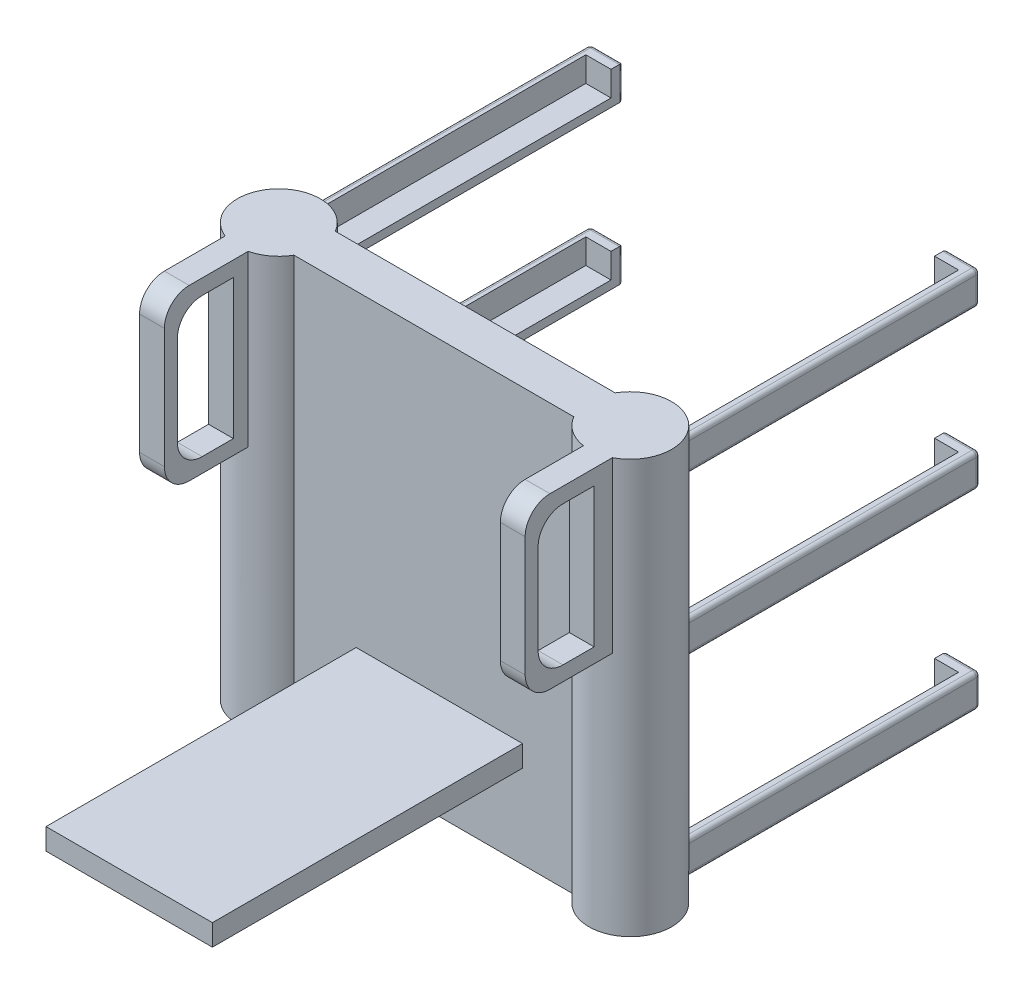
from build123d import *

# Parameters (mm, degrees)
EXTRUDE_2_DEPTH     = 100
EXTRUDE_3_REACH     = 145.614
SKETCH_5_W          = 13.54833094
SKETCH_5_H          = 33.732579075
CUT_EXTRUDE_1_DEPTH = 163.864974749
FILLET_1_R          = 6
SKETCH_6_W          = 8
SKETCH_6_H          = 92.249217012
CUT_EXTRUDE_2_DEPTH = 10
SKETCH_7_W          = 8
SKETCH_7_H          = 8
SKETCH_7_H_2        = 7.999996174
EXTRUDE_4_DEPTH     = 80
SKETCH_8_W          = 5.81077623
SKETCH_8_H          = 6
SKETCH_8_W_2        = 6.08515434
CUT_EXTRUDE_3_DEPTH = 70
FILLET_2_R          = 1
FILLET_3_R          = 1
SCALE_1_SCALE       = 0.4
SKETCH_10_W         = 16.095665038
SKETCH_10_H         = 2.058747854
EXTRUDE_5_DEPTH     = 30


with BuildPart() as part:
    # 草图1 → 凸台-拉伸2 (new body)
    with BuildSketch(Plane(origin=(0, 0, 0), x_dir=(1, 0, 0), z_dir=(0, 1, 0))):
        with BuildLine():
            Line((8.660254038, -5), (76.339745962, -5))
            ThreePointArc((76.339745962, -5), (95, 0), (76.339745962, 5))
            Line((76.339745962, 5), (8.660254038, 5))
            ThreePointArc((8.660254038, 5), (-10, 0), (8.660254038, -5))
        make_face()
    extrude(amount=EXTRUDE_2_DEPTH)

    # 草图4 → 凸台-拉伸3 (add, up to next)
    with BuildSketch(Plane.XY.offset(30), mode=Mode.PRIVATE) as extrude_3_sk1:
        Polygon((2.330127019, 100), (-0.669872981, 100), (-3.669872981, 100), (-3.669872981, 70), (-3.669872981, 59.040164867), (2.330127019, 59.040164867), (2.330127019, 70), align=None)
    extrude_3_tool1 = extrude(extrude_3_sk1.sketch, amount=-EXTRUDE_3_REACH, mode=Mode.PRIVATE) - part.part
    # 草图4 → 凸台-拉伸3 (add, up to next)
    with BuildSketch(Plane.XY.offset(30), mode=Mode.PRIVATE) as extrude_3_sk2:
        Polygon((89.57207168, 100), (85.669872981, 100), (83.57207168, 100), (83.57207168, 70), (83.57207168, 59.040164867), (89.57207168, 59.040164867), (89.57207168, 70), align=None)
    extrude_3_tool2 = extrude(extrude_3_sk2.sketch, amount=-EXTRUDE_3_REACH, mode=Mode.PRIVATE) - part.part
    add(extrude_3_tool1.solids().sort_by_distance((-0.669873, 79.520082, 30))[0])
    add(extrude_3_tool2.solids().sort_by_distance((86.572072, 79.520082, 30))[0])

    # 草图5 → 切除-拉伸1 (cut, through all)
    with BuildSketch(Plane(origin=(-30, 0, 0), x_dir=(0, 0, -1), z_dir=(1, 0, 0))):
        with Locations((-20.092124067, 79.446882552)):
            Rectangle(SKETCH_5_W, SKETCH_5_H)
    extrude(amount=CUT_EXTRUDE_1_DEPTH, mode=Mode.SUBTRACT)

    # 圆角1
    fillet_1_edges = [part.edges().sort_by_distance(p)[0] for p in [
        (-0.669872981, 59.040164867, 30),
        (-0.669872981, 100, 30),
        (86.57207168, 59.040164867, 30),
        (86.57207168, 100, 30),
        (-0.669872981, 96.31317209, 26.866289537),
        (86.57207168, 96.31317209, 26.866289537),
        (-0.669872981, 62.580593015, 26.866289537),
        (86.57207168, 62.580593015, 26.866289537),
    ]]
    fillet(fillet_1_edges, radius=FILLET_1_R)

    # 草图6 → 切除-拉伸2 (cut)
    with BuildSketch(Plane.XY.offset(-10)):
        with Locations((-0.669872981, 49.12740992)):
            Rectangle(SKETCH_6_W, SKETCH_6_H)
        Polygon((89.666936202, 3.002801414), (89.576715268, 95.252018426), (81.57207168, 95.252018426), (81.57207168, 3.002801414), align=None)
    extrude(amount=CUT_EXTRUDE_2_DEPTH, mode=Mode.SUBTRACT)

    # 草图7 → 凸台-拉伸4 (add)
    with BuildSketch(Plane.XY.offset(-80)):
        Polygon((89.666936202, 3.002801414), (81.57207168, 3.002801414), (81.57207168, 11.002801414), (89.659112098, 11.002801414), align=None)
        with Locations((-0.669872981, 7.002801414)):
            Rectangle(SKETCH_7_W, SKETCH_7_H)
        Polygon((89.621825735, 49.12740992), (81.57207168, 49.12740992), (81.57207168, 57.127406094), (89.614001635, 57.127406094), align=None)
        with Locations((-0.669872981, 53.127408007)):
            Rectangle(SKETCH_7_W, SKETCH_7_H_2)
        with Locations((-0.669872981, 91.252018426)):
            Rectangle(SKETCH_7_W, SKETCH_7_H)
        Polygon((81.57207168, 95.252018426), (89.576715268, 95.252018426), (89.584539372, 87.252018426), (81.57207168, 87.252018426), align=None)
    extrude(amount=EXTRUDE_4_DEPTH)

    # 草图8 → 切除-拉伸3 (cut)
    with BuildSketch(Plane.XY.offset(-77)):
        with Locations((84.477459795, 92.252018426)):
            Rectangle(SKETCH_8_W, SKETCH_8_H)
        with Locations((84.477459795, 54.127406094)):
            Rectangle(SKETCH_8_W, SKETCH_8_H)
        with Locations((84.477459795, 8.002801414)):
            Rectangle(SKETCH_8_W, SKETCH_8_H)
        with Locations((0.287549849, 8.002801414)):
            Rectangle(SKETCH_8_W_2, SKETCH_8_H)
        with Locations((0.287549849, 54.127406094)):
            Rectangle(SKETCH_8_W_2, SKETCH_8_H)
        with Locations((0.287549849, 92.252018426)):
            Rectangle(SKETCH_8_W_2, SKETCH_8_H)
    extrude(amount=CUT_EXTRUDE_3_DEPTH, mode=Mode.SUBTRACT)

    # 圆角2
    fillet_2_edges = [part.edges().sort_by_distance(p)[0] for p in [
        (89.58062732, 91.252018426, -80),
        (89.617913685, 53.127408007, -80),
        (89.66302415, 7.002801414, -80),
        (-4.669872981, 7.002801414, -80),
        (-4.669872981, 91.252018426, -80),
        (-4.669872981, 53.127408007, -80),
        (-4.669872981, 87.252018426, -44.421320118),
        (-4.669872981, 49.12740992, -44.421320118),
        (-4.669872981, 3.002801414, -44.421320118),
        (-4.669872981, 11.002801414, -44.421320118),
        (-4.669872981, 57.127406094, -44.421320118),
        (-4.669872981, 95.252018426, -44.421320118),
        (89.584539372, 87.252018426, -44.443590855),
        (89.621825735, 49.12740992, -44.433923964),
        (89.666936202, 3.002801414, -44.422095275),
        (89.659112098, 11.002801414, -44.42415739),
        (89.614001635, 57.127406094, -44.435960688),
        (89.576715268, 95.252018426, -44.445606746),
    ]]
    fillet(fillet_2_edges, radius=FILLET_2_R)

    # 圆角3
    # the kernel refuses this fillet: 1 mm, written as the material it takes off along each edge
    with BuildSketch(Plane(origin=(88.665957711, 4.002801414, -79), x_dir=(0.9999995217456177, 0.0009780125439468655, 0), z_dir=(0, 0, -1))) as fillet_3_piece_1_section:
        Polygon((0, 0), (FILLET_3_R, 0), (FILLET_3_R, FILLET_3_R * 1.00097849127), (-FILLET_3_R * 0.000978012543947, FILLET_3_R * 0.999999521746), align=None)
    fillet_3_piece_1 = extrude(amount=FILLET_3_R, mode=Mode.PRIVATE)
    fillet_3_piece_1 = fillet_3_piece_1 - Plane(origin=(88.665957711, 4.002801414, -79), x_dir=(-0.707452476334611, 0.7067609169500155, 0), z_dir=(0, 0, -1)) * Sphere(FILLET_3_R, mode=Mode.PRIVATE)
    add(fillet_3_piece_1, mode=Mode.SUBTRACT)
    with BuildSketch(Plane(origin=(88.660089633, 10.002801414, -79), x_dir=(0.9999995217456177, 0.0009780125439468655, 0), z_dir=(0, 0, -1))) as fillet_3_piece_2_section:
        Polygon((0, 0), (FILLET_3_R, 0), (FILLET_3_R, -FILLET_3_R * 0.999022465243), (FILLET_3_R * 0.000978012543947, -FILLET_3_R * 0.999999521746), align=None)
    fillet_3_piece_2 = extrude(amount=FILLET_3_R, mode=Mode.PRIVATE)
    fillet_3_piece_2 = fillet_3_piece_2 - Plane(origin=(88.660089633, 10.002801414, -79), x_dir=(-0.7067609169500155, -0.7074524763346108, 0), z_dir=(0, 0, -1)) * Sphere(FILLET_3_R, mode=Mode.PRIVATE)
    add(fillet_3_piece_2, mode=Mode.SUBTRACT)
    with BuildSketch(Plane(origin=(88.620847244, 50.12740992, -79), x_dir=(0.9999995217456177, 0.0009780125439480245, 0), z_dir=(0, 0, -1))) as fillet_3_piece_3_section:
        Polygon((0, 0), (FILLET_3_R, 0), (FILLET_3_R, FILLET_3_R * 1.00097849127), (-FILLET_3_R * 0.000978012543949, FILLET_3_R * 0.999999521746), align=None)
    fillet_3_piece_3 = extrude(amount=FILLET_3_R, mode=Mode.PRIVATE)
    fillet_3_piece_3 = fillet_3_piece_3 - Plane(origin=(88.620847244, 50.12740992, -79), x_dir=(-0.7074524763346112, 0.7067609169500152, 0), z_dir=(0, 0, -1)) * Sphere(FILLET_3_R, mode=Mode.PRIVATE)
    add(fillet_3_piece_3, mode=Mode.SUBTRACT)
    with BuildSketch(Plane(origin=(88.614979169, 56.127406094, -79), x_dir=(0.9999995217456177, 0.0009780125439480245, 0), z_dir=(0, 0, -1))) as fillet_3_piece_4_section:
        Polygon((0, 0), (FILLET_3_R, 0), (FILLET_3_R, -FILLET_3_R * 0.999022465243), (FILLET_3_R * 0.000978012543948, -FILLET_3_R * 0.999999521746), align=None)
    fillet_3_piece_4 = extrude(amount=FILLET_3_R, mode=Mode.PRIVATE)
    fillet_3_piece_4 = fillet_3_piece_4 - Plane(origin=(88.614979169, 56.127406094, -79), x_dir=(-0.7067609169500151, -0.7074524763346115, 0), z_dir=(0, 0, -1)) * Sphere(FILLET_3_R, mode=Mode.PRIVATE)
    add(fillet_3_piece_4, mode=Mode.SUBTRACT)
    with BuildSketch(Plane(origin=(-3.669872981, 94.252018426, -79), x_dir=(0, 0, -1), z_dir=(0, 1, 0))) as fillet_3_piece_5_section:
        Polygon((0, 0), (FILLET_3_R, 0), (FILLET_3_R, FILLET_3_R), (0, FILLET_3_R), align=None)
    fillet_3_piece_5 = extrude(amount=FILLET_3_R, mode=Mode.PRIVATE)
    fillet_3_piece_5 = fillet_3_piece_5 - Plane(origin=(-3.669872981, 94.252018426, -79), x_dir=(0.7071067811865475, 0, 0.7071067811865475), z_dir=(0, 1, 0)) * Sphere(FILLET_3_R, mode=Mode.PRIVATE)
    add(fillet_3_piece_5, mode=Mode.SUBTRACT)
    with BuildSketch(Plane(origin=(-3.669872981, 88.252018426, -79), x_dir=(0, 0, -1), z_dir=(0, -1, 0))) as fillet_3_piece_6_section:
        Polygon((0, 0), (FILLET_3_R, 0), (FILLET_3_R, -FILLET_3_R), (0, -FILLET_3_R), align=None)
    fillet_3_piece_6 = extrude(amount=FILLET_3_R, mode=Mode.PRIVATE)
    fillet_3_piece_6 = fillet_3_piece_6 - Plane(origin=(-3.669872981, 88.252018426, -79), x_dir=(0.7071067811865475, 0, 0.7071067811865475), z_dir=(0, -1, 0)) * Sphere(FILLET_3_R, mode=Mode.PRIVATE)
    add(fillet_3_piece_6, mode=Mode.SUBTRACT)
    with BuildSketch(Plane(origin=(-3.669872981, 10.002801414, -79), x_dir=(0, 0, -1), z_dir=(0, 1, 0))) as fillet_3_piece_7_section:
        Polygon((0, 0), (FILLET_3_R, 0), (FILLET_3_R, FILLET_3_R), (0, FILLET_3_R), align=None)
    fillet_3_piece_7 = extrude(amount=FILLET_3_R, mode=Mode.PRIVATE)
    fillet_3_piece_7 = fillet_3_piece_7 - Plane(origin=(-3.669872981, 10.002801414, -79), x_dir=(0.7071067811865475, 0, 0.7071067811865475), z_dir=(0, 1, 0)) * Sphere(FILLET_3_R, mode=Mode.PRIVATE)
    add(fillet_3_piece_7, mode=Mode.SUBTRACT)
    with BuildSketch(Plane(origin=(-3.669872981, 4.002801414, -79), x_dir=(0, 0, -1), z_dir=(0, -1, 0))) as fillet_3_piece_8_section:
        Polygon((0, 0), (FILLET_3_R, 0), (FILLET_3_R, -FILLET_3_R), (0, -FILLET_3_R), align=None)
    fillet_3_piece_8 = extrude(amount=FILLET_3_R, mode=Mode.PRIVATE)
    fillet_3_piece_8 = fillet_3_piece_8 - Plane(origin=(-3.669872981, 4.002801414, -79), x_dir=(0.7071067811865475, 0, 0.7071067811865475), z_dir=(0, -1, 0)) * Sphere(FILLET_3_R, mode=Mode.PRIVATE)
    add(fillet_3_piece_8, mode=Mode.SUBTRACT)
    with BuildSketch(Plane(origin=(-3.669872981, 56.127406094, -79), x_dir=(0, 0, -1), z_dir=(0, 1, 0))) as fillet_3_piece_9_section:
        Polygon((0, 0), (FILLET_3_R, 0), (FILLET_3_R, FILLET_3_R), (0, FILLET_3_R), align=None)
    fillet_3_piece_9 = extrude(amount=FILLET_3_R, mode=Mode.PRIVATE)
    fillet_3_piece_9 = fillet_3_piece_9 - Plane(origin=(-3.669872981, 56.127406094, -79), x_dir=(0.7071067811865475, 0, 0.7071067811865475), z_dir=(0, 1, 0)) * Sphere(FILLET_3_R, mode=Mode.PRIVATE)
    add(fillet_3_piece_9, mode=Mode.SUBTRACT)
    with BuildSketch(Plane(origin=(-3.669872981, 50.12740992, -79), x_dir=(0, 0, -1), z_dir=(0, -1, 0))) as fillet_3_piece_10_section:
        Polygon((0, 0), (FILLET_3_R, 0), (FILLET_3_R, -FILLET_3_R), (0, -FILLET_3_R), align=None)
    fillet_3_piece_10 = extrude(amount=FILLET_3_R, mode=Mode.PRIVATE)
    fillet_3_piece_10 = fillet_3_piece_10 - Plane(origin=(-3.669872981, 50.12740992, -79), x_dir=(0.7071067811865475, 0, 0.7071067811865475), z_dir=(0, -1, 0)) * Sphere(FILLET_3_R, mode=Mode.PRIVATE)
    add(fillet_3_piece_10, mode=Mode.SUBTRACT)
    with BuildSketch(Plane(origin=(88.58356088, 88.252018426, -79), x_dir=(0.9999995217456177, 0.0009780125439468638, 0), z_dir=(0, 0, -1))) as fillet_3_piece_11_section:
        Polygon((0, 0), (FILLET_3_R, 0), (FILLET_3_R, FILLET_3_R * 1.00097849127), (-FILLET_3_R * 0.000978012543947, FILLET_3_R * 0.999999521746), align=None)
    fillet_3_piece_11 = extrude(amount=FILLET_3_R, mode=Mode.PRIVATE)
    fillet_3_piece_11 = fillet_3_piece_11 - Plane(origin=(88.58356088, 88.252018426, -79), x_dir=(-0.7074524763346112, 0.7067609169500153, 0), z_dir=(0, 0, -1)) * Sphere(FILLET_3_R, mode=Mode.PRIVATE)
    add(fillet_3_piece_11, mode=Mode.SUBTRACT)
    with BuildSketch(Plane(origin=(88.577692802, 94.252018426, -79), x_dir=(0.9999995217456177, 0.0009780125439468638, 0), z_dir=(0, 0, -1))) as fillet_3_piece_12_section:
        Polygon((0, 0), (FILLET_3_R, 0), (FILLET_3_R, -FILLET_3_R * 0.999022465243), (FILLET_3_R * 0.000978012543947, -FILLET_3_R * 0.999999521746), align=None)
    fillet_3_piece_12 = extrude(amount=FILLET_3_R, mode=Mode.PRIVATE)
    fillet_3_piece_12 = fillet_3_piece_12 - Plane(origin=(88.577692802, 94.252018426, -79), x_dir=(-0.7067609169500155, -0.7074524763346111, 0), z_dir=(0, 0, -1)) * Sphere(FILLET_3_R, mode=Mode.PRIVATE)
    add(fillet_3_piece_12, mode=Mode.SUBTRACT)
    with BuildSketch(Plane(origin=(81.57207168, 0.502801414, -80), x_dir=(0, 0, 1), z_dir=(0, 1, 0)), Plane(origin=(3.330127019, 97.752018426, -80), x_dir=(0, 0, 1), z_dir=(0, -1, 0)), Plane(origin=(3.330127019, 13.502801414, -80), x_dir=(0, 0, 1), z_dir=(0, -1, 0)), Plane(origin=(81.57207168, 84.752018426, -80), x_dir=(0, 0, 1), z_dir=(0, 1, 0))) as fillet_3_piece_13:
        with BuildLine():
            CenterArc((FILLET_3_R, FILLET_3_R), FILLET_3_R, 180, 90)
            Line((0, FILLET_3_R), (0, 0))
            Line((0, 0), (FILLET_3_R, 0))
        make_face()
    extrude(amount=13, mode=Mode.SUBTRACT)
    with BuildSketch(Plane(origin=(88.665957711, 3.002801414, -80), x_dir=(0, 0, 1), z_dir=(-1, 0, 0))) as fillet_3_piece_14:
        with BuildLine():
            CenterArc((FILLET_3_R, FILLET_3_R), FILLET_3_R, 180, 90)
            Line((0, FILLET_3_R), (0, 0))
            Line((0, 0), (FILLET_3_R, 0))
        make_face()
    extrude(amount=9.593886031, mode=Mode.SUBTRACT)
    with BuildSketch(Plane(origin=(79.07207168, 11.002801414, -80), x_dir=(0, 0, 1), z_dir=(1, 0, 0))) as fillet_3_piece_15:
        with BuildLine():
            CenterArc((FILLET_3_R, FILLET_3_R), FILLET_3_R, 180, 90)
            Line((0, FILLET_3_R), (0, 0))
            Line((0, 0), (FILLET_3_R, 0))
        make_face()
    extrude(amount=9.588017953, mode=Mode.SUBTRACT)
    with BuildSketch(Plane(origin=(81.57207168, 46.62740992, -80), x_dir=(0, 0, 1), z_dir=(0, 1, 0))) as fillet_3_piece_16:
        with BuildLine():
            CenterArc((FILLET_3_R, FILLET_3_R), FILLET_3_R, 180, 90)
            Line((0, FILLET_3_R), (0, 0))
            Line((0, 0), (FILLET_3_R, 0))
        make_face()
    extrude(amount=12.999996174, mode=Mode.SUBTRACT)
    with BuildSketch(Plane(origin=(88.620847244, 49.12740992, -80), x_dir=(0, 0, 1), z_dir=(-1, 0, 0))) as fillet_3_piece_17:
        with BuildLine():
            CenterArc((FILLET_3_R, FILLET_3_R), FILLET_3_R, 180, 90)
            Line((0, FILLET_3_R), (0, 0))
            Line((0, 0), (FILLET_3_R, 0))
        make_face()
    extrude(amount=9.548775564, mode=Mode.SUBTRACT)
    with BuildSketch(Plane(origin=(79.07207168, 57.127406094, -80), x_dir=(0, 0, 1), z_dir=(1, 0, 0))) as fillet_3_piece_18:
        with BuildLine():
            CenterArc((FILLET_3_R, FILLET_3_R), FILLET_3_R, 180, 90)
            Line((0, FILLET_3_R), (0, 0))
            Line((0, 0), (FILLET_3_R, 0))
        make_face()
    extrude(amount=9.542907489, mode=Mode.SUBTRACT)
    with BuildSketch(Plane(origin=(-3.669872981, 95.252018426, -80), x_dir=(0, 0, 1), z_dir=(1, 0, 0)), Plane(origin=(5.830127019, 87.252018426, -80), x_dir=(0, 0, 1), z_dir=(-1, 0, 0)), Plane(origin=(-3.669872981, 11.002801414, -80), x_dir=(0, 0, 1), z_dir=(1, 0, 0)), Plane(origin=(5.830127019, 3.002801414, -80), x_dir=(0, 0, 1), z_dir=(-1, 0, 0))) as fillet_3_piece_19:
        with BuildLine():
            CenterArc((FILLET_3_R, FILLET_3_R), FILLET_3_R, 180, 90)
            Line((0, FILLET_3_R), (0, 0))
            Line((0, 0), (FILLET_3_R, 0))
        make_face()
    extrude(amount=9.5, mode=Mode.SUBTRACT)
    with BuildSketch(Plane(origin=(3.330127019, 46.62740992, -80), x_dir=(0, 0, 1), z_dir=(0, 1, 0))) as fillet_3_piece_20:
        with BuildLine():
            CenterArc((FILLET_3_R, -FILLET_3_R), FILLET_3_R, 90, 90)
            Line((0, -FILLET_3_R), (0, 0))
            Line((0, 0), (FILLET_3_R, 0))
        make_face()
    extrude(amount=12.999996174, mode=Mode.SUBTRACT)
    with BuildSketch(Plane(origin=(5.830127019, 57.127406094, -80), x_dir=(0, 0, 1), z_dir=(-1, 0, 0)), Plane(origin=(-3.669872981, 49.12740992, -80), x_dir=(0, 0, 1), z_dir=(1, 0, 0))) as fillet_3_piece_21:
        with BuildLine():
            CenterArc((FILLET_3_R, -FILLET_3_R), FILLET_3_R, 90, 90)
            Line((0, -FILLET_3_R), (0, 0))
            Line((0, 0), (FILLET_3_R, 0))
        make_face()
    extrude(amount=9.5, mode=Mode.SUBTRACT)
    with BuildSketch(Plane(origin=(88.58356088, 87.252018426, -80), x_dir=(0, 0, 1), z_dir=(-1, 0, 0))) as fillet_3_piece_22:
        with BuildLine():
            CenterArc((FILLET_3_R, FILLET_3_R), FILLET_3_R, 180, 90)
            Line((0, FILLET_3_R), (0, 0))
            Line((0, 0), (FILLET_3_R, 0))
        make_face()
    extrude(amount=9.511489201, mode=Mode.SUBTRACT)
    with BuildSketch(Plane(origin=(79.07207168, 95.252018426, -80), x_dir=(0, 0, 1), z_dir=(1, 0, 0))) as fillet_3_piece_23:
        with BuildLine():
            CenterArc((FILLET_3_R, FILLET_3_R), FILLET_3_R, 180, 90)
            Line((0, FILLET_3_R), (0, 0))
            Line((0, 0), (FILLET_3_R, 0))
        make_face()
    extrude(amount=9.505621123, mode=Mode.SUBTRACT)


with BuildPart() as part_1:
    # 缩放比例1: scaled about (42.655927146, 51.005075462, -3.237606987)
    add(part.part.scale(SCALE_1_SCALE).moved(Location((25.593556288, 30.603045277, -1.942564192))))


with BuildPart() as extrude_5_tool:
    # 草图10 → 凸台-拉伸5 (new body)
    with BuildSketch(Plane.XY.offset(0.057440609)):
        with Locations((43.123839108, 39.716636815)):
            Rectangle(SKETCH_10_W, SKETCH_10_H)
    extrude(amount=EXTRUDE_5_DEPTH)


with BuildPart() as part_2:
    add(part_1.part)


with BuildPart() as part_3:
    # 凸台-拉伸5: joined with extrude_5_tool
    add(part_2.part.fuse(extrude_5_tool.part, tol=0.00001))


solid = part_3.part
